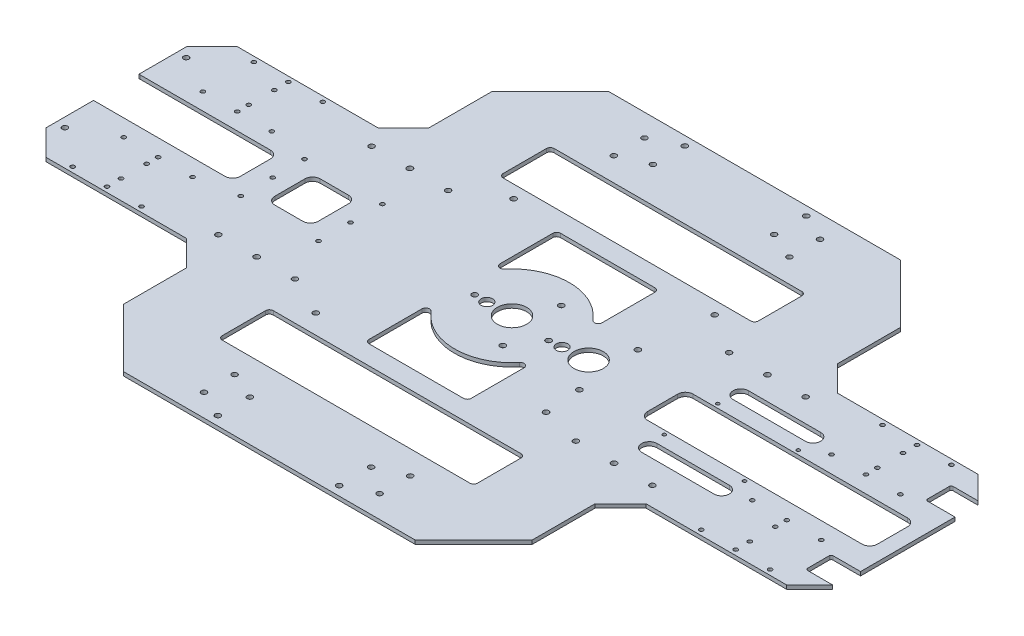
from build123d import *

# Parameters (mm, degrees)
EXTRUDE_1_DEPTH      = 3
CHAMFER_1_SIZE       = 20
SKETCH_2_W           = 320
SKETCH_2_H           = 20
CUT_EXTRUDE_1_DEPTH  = 5
CHAMFER_2_SIZE       = 50
SKETCH_3_R           = 2.1
SKETCH_3_R_2         = 2.099999999
SKETCH_3_R_3         = 2.100000001
CUT_EXTRUDE_2_DEPTH  = 80
SKETCH_4_R           = 2.15
CUT_EXTRUDE_3_DEPTH  = 10
SKETCH_5_R           = 1.6
SKETCH_5_R_2         = 2.1
SKETCH_5_R_3         = 2.2
CUT_EXTRUDE_4_DEPTH  = 29
EXTRUDE_2_DEPTH      = 3
SKETCH_7_W           = 23
SKETCH_7_H           = 20
CUT_EXTRUDE_5_DEPTH  = 3
FILLET_1_R           = 1.5
SKETCH_9_R           = 2.15
CUT_EXTRUDE_6_DEPTH  = 3
SKETCH_10_R          = 11.5
SKETCH_10_R_2        = 4.5
SKETCH_10_R_3        = 2.15
CUT_EXTRUDE_7_DEPTH  = 5
SKETCH_11_R          = 1.6
CUT_EXTRUDE_8_DEPTH  = 10
SKETCH_13_R          = 1.35
CUT_EXTRUDE_9_DEPTH  = 3
CUT_EXTRUDE_10_DEPTH = 3
CUT_EXTRUDE_START    = -3
SKETCH_15_R          = 2.15
SKETCH_15_R_2        = 4.5
SKETCH_15_R_3        = 11.5
CUT_EXTRUDE_11_DEPTH = 3
CUT_EXTRUDE_12_DEPTH = 3
CUT_EXTRUDE_13_DEPTH = 3


with BuildPart() as part:
    # 草图1 → 凸台-拉伸1 (new body)
    with BuildSketch(Plane(origin=(0, 0, 0), x_dir=(1, 0, 0), z_dir=(0, 1, 0))):
        Polygon((-310, -75), (-160, -75), (-160, -200), (160, -200), (160, -75), (310, -75), (310, 75), (160, 75), (160, 200), (-160, 200), (-160, 75), (-310, 75), align=None)
    extrude(amount=EXTRUDE_1_DEPTH)

    # 倒角1
    chamfer_1_edges = [part.edges().sort_by_distance(p)[0] for p in [
        (-160, 1.5, -75),
        (-310, 1.5, -75),
        (-310, 1.5, 75),
        (-160, 1.5, 75),
        (160, 1.5, 75),
        (160, 1.5, -75),
        (310, 1.5, 75),
        (310, 1.5, -75),
    ]]
    chamfer(chamfer_1_edges, length=CHAMFER_1_SIZE)

    # 草图2 → 切除-拉伸1 (cut)
    with BuildSketch(Plane(origin=(0, 3, 0), x_dir=(1, 0, 0), z_dir=(0, 1, 0))):
        with Locations((0, 190)):
            Rectangle(SKETCH_2_W, SKETCH_2_H)
        with Locations((0, -190)):
            Rectangle(SKETCH_2_W, SKETCH_2_H)
    extrude(amount=-CUT_EXTRUDE_1_DEPTH, mode=Mode.SUBTRACT)

    # 倒角2
    chamfer_2_edges = [part.edges().sort_by_distance(p)[0] for p in [
        (-160, 1.5, -180),
        (-160, 1.5, 180),
        (160, 1.5, -180),
        (160, 1.5, 180),
    ]]
    chamfer(chamfer_2_edges, length=CHAMFER_2_SIZE)

    # 草图3 → 切除-拉伸2 (cut)
    with BuildSketch(Plane(origin=(0, 3, 0), x_dir=(1, 0, 0), z_dir=(0, 1, 0))):
        with Locations((-327.700177837, 47.5)):
            Circle(SKETCH_3_R)
        with Locations((-302.700177837, 47.5)):
            Circle(SKETCH_3_R)
        with Locations((-47.5, 182.826293853)):
            Circle(SKETCH_3_R)
        with Locations((-47.5, 157.826293853)):
            Circle(SKETCH_3_R)
        with Locations((47.5, 182.826293853)):
            Circle(SKETCH_3_R)
        with Locations((47.5, 157.826293853)):
            Circle(SKETCH_3_R)
        with Locations((302.700177837, 47.5)):
            Circle(SKETCH_3_R_2)
        with Locations((327.700177837, 47.5)):
            Circle(SKETCH_3_R_2)
        with Locations((-68.75, 172.5)):
            Circle(SKETCH_3_R)
        with Locations((-68.75, 148.5)):
            Circle(SKETCH_3_R)
        with Locations((68.75, 172.5)):
            Circle(SKETCH_3_R)
        with Locations((68.75, 148.5)):
            Circle(SKETCH_3_R)
        with Locations((68.75, -148.5)):
            Circle(SKETCH_3_R)
        with Locations((68.75, -172.5)):
            Circle(SKETCH_3_R)
        with Locations((-68.75, -148.5)):
            Circle(SKETCH_3_R)
        with Locations((-68.75, -172.5)):
            Circle(SKETCH_3_R)
        with Locations((327.700177837, -47.5)):
            Circle(SKETCH_3_R_3)
        with Locations((302.700177837, -47.5)):
            Circle(SKETCH_3_R_3)
        with Locations((47.5, -157.826293853)):
            Circle(SKETCH_3_R)
        with Locations((47.5, -182.826293853)):
            Circle(SKETCH_3_R)
        with Locations((-47.5, -157.826293853)):
            Circle(SKETCH_3_R)
        with Locations((-47.5, -182.826293853)):
            Circle(SKETCH_3_R)
        with Locations((-302.700177837, -47.5)):
            Circle(SKETCH_3_R)
        with Locations((-327.700177837, -47.5)):
            Circle(SKETCH_3_R)
    extrude(amount=-CUT_EXTRUDE_2_DEPTH, mode=Mode.SUBTRACT)

    # 草图4 → 切除-拉伸3 (cut)
    with BuildSketch(Plane.XZ):
        with Locations((-78.739999994, 74.909999989)):
            Circle(SKETCH_4_R)
        with Locations((-78.739999994, -80.01)):
            Circle(SKETCH_4_R)
        with Locations((78.740000006, -80.01)):
            Circle(SKETCH_4_R)
        with Locations((78.740000006, 52.07)):
            Circle(SKETCH_4_R)
    extrude(amount=-CUT_EXTRUDE_3_DEPTH, mode=Mode.SUBTRACT)

    # 草图5 → 切除-拉伸4 (cut)
    with BuildSketch(Plane(origin=(0, 3, 0), x_dir=(1, 0, 0), z_dir=(0, 1, 0))):
        with Locations((219.200177837, 71)):
            Circle(SKETCH_5_R)
        with Locations((273.200177837, 71)):
            Circle(SKETCH_5_R)
        with Locations((246.200177837, 71)):
            Circle(SKETCH_5_R)
        with Locations((219.200177837, 30.998400192)):
            Circle(SKETCH_5_R)
        with Locations((246.200177837, 30.998400192)):
            Circle(SKETCH_5_R)
        with Locations((273.200177837, 30.998400192)):
            Circle(SKETCH_5_R)
        with Locations((246.200177837, 60)):
            Circle(SKETCH_5_R)
        with Locations((246.200177837, 40)):
            Circle(SKETCH_5_R)
        with Locations((246.200177837, -40)):
            Circle(SKETCH_5_R)
        with Locations((246.200177837, -60)):
            Circle(SKETCH_5_R)
        with Locations((273.200177837, -30.998400192)):
            Circle(SKETCH_5_R)
        with Locations((246.200177837, -30.998400192)):
            Circle(SKETCH_5_R)
        with Locations((219.200177837, -30.998400192)):
            Circle(SKETCH_5_R)
        with Locations((246.200177837, -71)):
            Circle(SKETCH_5_R)
        with Locations((273.200177837, -71)):
            Circle(SKETCH_5_R)
        with Locations((219.200177837, -71)):
            Circle(SKETCH_5_R)
        with Locations((-219.200177837, -71)):
            Circle(SKETCH_5_R)
        with Locations((-273.200177837, -71)):
            Circle(SKETCH_5_R)
        with Locations((-246.200177837, -71)):
            Circle(SKETCH_5_R)
        with Locations((-219.200177837, -30.998400192)):
            Circle(SKETCH_5_R)
        with Locations((-246.200177837, -30.998400192)):
            Circle(SKETCH_5_R)
        with Locations((-273.200177837, -30.998400192)):
            Circle(SKETCH_5_R)
        with Locations((-246.200177837, -60)):
            Circle(SKETCH_5_R)
        with Locations((-246.200177837, -40)):
            Circle(SKETCH_5_R)
        with Locations((-246.200177837, 40)):
            Circle(SKETCH_5_R)
        with Locations((-246.200177837, 60)):
            Circle(SKETCH_5_R)
        with Locations((-273.200177837, 30.998400192)):
            Circle(SKETCH_5_R)
        with Locations((-246.200177837, 30.998400192)):
            Circle(SKETCH_5_R)
        with Locations((-219.200177837, 30.998400192)):
            Circle(SKETCH_5_R)
        with Locations((-246.200177837, 71)):
            Circle(SKETCH_5_R)
        with Locations((-273.200177837, 71)):
            Circle(SKETCH_5_R)
        with Locations((-219.200177837, 71)):
            Circle(SKETCH_5_R)
        with Locations((170, -60)):
            Circle(SKETCH_5_R_2)
        with Locations((110, -60)):
            Circle(SKETCH_5_R_2)
        with Locations((140, -60)):
            Circle(SKETCH_5_R_3)
        with Locations((140, 60)):
            Circle(SKETCH_5_R_3)
        with Locations((110, 60)):
            Circle(SKETCH_5_R_2)
        with Locations((170, 60)):
            Circle(SKETCH_5_R_2)
        with Locations((-170, 60)):
            Circle(SKETCH_5_R_2)
        with Locations((-110, 60)):
            Circle(SKETCH_5_R_2)
        with Locations((-140, 60)):
            Circle(SKETCH_5_R_3)
        with Locations((-140, -60)):
            Circle(SKETCH_5_R_3)
        with Locations((-110, -60)):
            Circle(SKETCH_5_R_2)
        with Locations((-170, -60)):
            Circle(SKETCH_5_R_2)
    extrude(amount=-CUT_EXTRUDE_4_DEPTH, mode=Mode.SUBTRACT)

    # 草图6 → 凸台-拉伸2 (add)
    with BuildSketch(Plane(origin=(0, 3, 0), x_dir=(1, 0, 0), z_dir=(0, 1, 0))):
        Polygon((-160, 144.142135624), (-160, 130), (-110, 180), (110, 180), (160, 130), (160, 144.142135624), (114.142135624, 190), (-114.142135624, 190), align=None)
        Polygon((114.142135624, -190), (160, -144.142135624), (160, -130), (110, -180), (-110, -180), (-160, -130), (-160, -144.142135624), (-114.142135624, -190), align=None)
    extrude(amount=-EXTRUDE_2_DEPTH)

    # 草图7 → 切除-拉伸5 (cut)
    with BuildSketch(Plane(origin=(0, 3, 0), x_dir=(1, 0, 0), z_dir=(0, 1, 0))):
        with Locations((298.5, 47)):
            Rectangle(SKETCH_7_W, SKETCH_7_H)
        with Locations((298.5, -47)):
            Rectangle(SKETCH_7_W, SKETCH_7_H)
    extrude(amount=-CUT_EXTRUDE_5_DEPTH, mode=Mode.SUBTRACT)

    # 圆角1
    fillet_1_edges = [part.edges().sort_by_distance(p)[0] for p in [
        (287, 1.5, 37),
        (287, 1.5, 57),
        (287, 1.5, -37),
        (287, 1.5, -57),
    ]]
    fillet(fillet_1_edges, radius=FILLET_1_R)

    # 草图9 → 切除-拉伸6 (cut)
    with BuildSketch(Plane.XZ):
        with Locations((-47.500000014, 182.878427071)):
            Circle(SKETCH_9_R)
        with Locations((47.499999986, 182.878427071)):
            Circle(SKETCH_9_R)
        with Locations((47.499999986, -182.878427071)):
            Circle(SKETCH_9_R)
        with Locations((-47.500000014, -182.878427071)):
            Circle(SKETCH_9_R)
    extrude(amount=-CUT_EXTRUDE_6_DEPTH, mode=Mode.SUBTRACT)

    # 草图10 → 切除-拉伸7 (cut)
    with BuildSketch(Plane.XZ):
        with Locations((60, 0)):
            Circle(SKETCH_10_R)
        with Locations((40.818485661, 1.62234634)):
            Circle(SKETCH_10_R_2)
        with Locations((72.33180035, -26.247413208)):
            Circle(SKETCH_10_R_3)
        with Locations((76.565026447, 23.803358982)):
            Circle(SKETCH_10_R_3)
        with Locations((31.103173203, 2.444054227)):
            Circle(SKETCH_10_R_3)
    extrude(amount=-CUT_EXTRUDE_7_DEPTH, mode=Mode.SUBTRACT)

    # 草图11 → 切除-拉伸8 (cut)
    with BuildSketch(Plane.XZ):
        with Locations((-126.5, -25)):
            Circle(SKETCH_11_R)
        with Locations((-187.5, -25)):
            Circle(SKETCH_11_R)
        with Locations((-126.5, 0)):
            Circle(SKETCH_11_R)
        with Locations((-187.4745166, 0)):
            Circle(SKETCH_11_R)
        with Locations((-187.4745166, 25)):
            Circle(SKETCH_11_R)
        with Locations((-126.5, 25)):
            Circle(SKETCH_11_R)
    extrude(amount=-CUT_EXTRUDE_8_DEPTH, mode=Mode.SUBTRACT)

    # 草图13 → 切除-拉伸9 (cut)
    with BuildSketch(Plane(origin=(0, 3, 0), x_dir=(1, 0, 0), z_dir=(0, 1, 0))):
        with Locations((140.200177837, 21)):
            Circle(SKETCH_13_R)
        with Locations((203.200177837, 21)):
            Circle(SKETCH_13_R)
        with Locations((203.200177837, -21)):
            Circle(SKETCH_13_R)
        with Locations((140.200177837, -21)):
            Circle(SKETCH_13_R)
        with BuildLine():
            Line((143.400177837, 41.8), (200.000177837, 41.8))
            ThreePointArc((200.000177837, 41.8), (206.000177837, 35.8), (200.000177837, 29.8))
            Line((200.000177837, 29.8), (143.400177837, 29.8))
            ThreePointArc((143.400177837, 29.8), (137.400177837, 35.8), (143.400177837, 41.8))
        make_face()
        with BuildLine():
            Line((143.400177837, -29.8), (200.000177837, -29.8))
            ThreePointArc((200.000177837, -29.8), (206.000177837, -35.8), (200.000177837, -41.8))
            Line((200.000177837, -41.8), (143.400177837, -41.8))
            ThreePointArc((143.400177837, -41.8), (137.400177837, -35.8), (143.400177837, -29.8))
        make_face()
    extrude(amount=-CUT_EXTRUDE_9_DEPTH, mode=Mode.SUBTRACT)

    # 草图14 → 切除-拉伸10 (cut)
    with BuildSketch(Plane(origin=(0, 3, 0), x_dir=(1, 0, 0), z_dir=(0, 1, 0))):
        with BuildLine():
            Line((292, 17.8), (124, 17.8))
            ThreePointArc((124, 17.8), (119.757359313, 16.042640687), (118, 11.8))
            Line((118, 11.8), (118, -11.8))
            ThreePointArc((118, -11.8), (119.757359313, -16.042640687), (124, -17.8))
            Line((124, -17.8), (292, -17.8))
            ThreePointArc((292, -17.8), (296.242640687, -16.042640687), (298, -11.8))
            Line((298, -11.8), (298, 11.8))
            ThreePointArc((298, 11.8), (296.242640687, 16.042640687), (292, 17.8))
        make_face()
    extrude(amount=-CUT_EXTRUDE_10_DEPTH, mode=Mode.SUBTRACT)

    # 草图15 → 切除-拉伸11 (cut)
    with BuildSketch(Plane(origin=(0, 3, 0), x_dir=(1, 0, 0), z_dir=(0, 1, 0)).offset(CUT_EXTRUDE_START)):
        with Locations((76.565026447, -23.803358982)):
            Circle(SKETCH_15_R)
        with Locations((72.33180035, 26.247413208)):
            Circle(SKETCH_15_R)
        with Locations((31.103173203, -2.444054227)):
            Circle(SKETCH_15_R)
        with Locations((40.818485661, -1.62234634)):
            Circle(SKETCH_15_R_2)
        with Locations((60, 0)):
            Circle(SKETCH_15_R_3)
        with Locations((16.565026447, -23.803358982)):
            Circle(SKETCH_15_R)
        with Locations((12.33180035, 26.247413208)):
            Circle(SKETCH_15_R)
        with Locations((-28.896826797, -0.34594168)):
            Circle(SKETCH_15_R)
        with Locations((-19.181514339, -0.523817525)):
            Circle(SKETCH_15_R_2)
        Circle(SKETCH_15_R_3)
    extrude(amount=CUT_EXTRUDE_11_DEPTH, mode=Mode.SUBTRACT)

    # 草图16 → 切除-拉伸12 (cut)
    with BuildSketch(Plane(origin=(0, 3, 0), x_dir=(1, 0, 0), z_dir=(0, 1, 0))):
        with BuildLine():
            Line((97, 130), (-97, 130))
            ThreePointArc((-97, 130), (-99.121320344, 129.121320344), (-100, 127))
            Line((-100, 127), (-100, 93))
            ThreePointArc((-100, 93), (-99.121320344, 90.878679656), (-97, 90))
            Line((-97, 90), (97, 90))
            ThreePointArc((97, 90), (99.121320344, 90.878679656), (100, 93))
            Line((100, 93), (100, 127))
            ThreePointArc((100, 127), (99.121320344, 129.121320344), (97, 130))
        make_face()
        with BuildLine():
            Line((97, -90), (-97, -90))
            ThreePointArc((-97, -90), (-99.121320344, -90.878679656), (-100, -93))
            Line((-100, -93), (-100, -127))
            ThreePointArc((-100, -127), (-99.121320344, -129.121320344), (-97, -130))
            Line((-97, -130), (97, -130))
            ThreePointArc((97, -130), (99.121320344, -129.121320344), (100, -127))
            Line((100, -127), (100, -93))
            ThreePointArc((100, -93), (99.121320344, -90.878679656), (97, -90))
        make_face()
        with BuildLine():
            ThreePointArc((-37, 75), (-39.121320344, 74.121320344), (-40, 72))
            Line((-40, 72), (-40, 30.577769703))
            ThreePointArc((-40, 30.577769703), (-38.015504801, 27.754872255), (-34.6875, 28.666659096))
            ThreePointArc((-34.6875, 28.666659096), (0, 45), (34.6875, 28.666659096))
            ThreePointArc((34.6875, 28.666659096), (38.015504801, 27.754872255), (40, 30.577769703))
            Line((40, 30.577769703), (40, 72))
            ThreePointArc((40, 72), (39.121320344, 74.121320344), (37, 75))
            Line((37, 75), (-37, 75))
        make_face()
        with BuildLine():
            ThreePointArc((-34.6875, -28.666659096), (-38.015504801, -27.754872255), (-40, -30.577769703))
            Line((-40, -30.577769703), (-40, -72))
            ThreePointArc((-40, -72), (-39.121320344, -74.121320344), (-37, -75))
            Line((-37, -75), (37, -75))
            ThreePointArc((37, -75), (39.121320344, -74.121320344), (40, -72))
            Line((40, -72), (40, -30.577769703))
            ThreePointArc((40, -30.577769703), (38.015504801, -27.754872255), (34.6875, -28.666659096))
            ThreePointArc((34.6875, -28.666659096), (0, -45), (-34.6875, -28.666659096))
        make_face()
    extrude(amount=-CUT_EXTRUDE_12_DEPTH, mode=Mode.SUBTRACT)

    # 草图17 → 切除-拉伸13 (cut)
    with BuildSketch(Plane(origin=(0, 3, 0), x_dir=(1, 0, 0), z_dir=(0, 1, 0))):
        with BuildLine():
            Line((-308.827907457, 17.8), (-207, 17.8))
            ThreePointArc((-207, 17.8), (-202.757359313, 16.042640687), (-201, 11.8))
            Line((-201, 11.8), (-201, -11.8))
            ThreePointArc((-201, -11.8), (-202.757359313, -16.042640687), (-207, -17.8))
            Line((-207, -17.8), (-308.827907457, -17.8))
            ThreePointArc((-308.827907457, -17.8), (-313.070548144, -16.042640687), (-314.827907457, -11.8))
            Line((-314.827907457, -11.8), (-314.827907457, 11.8))
            ThreePointArc((-314.827907457, 11.8), (-313.070548144, 16.042640687), (-308.827907457, 17.8))
        make_face()
        with BuildLine():
            Line((-168, 17.8), (-146, 17.8))
            ThreePointArc((-146, 17.8), (-141.757359313, 16.042640687), (-140, 11.8))
            Line((-140, 11.8), (-140, -11.8))
            ThreePointArc((-140, -11.8), (-141.757359313, -16.042640687), (-146, -17.8))
            Line((-146, -17.8), (-168, -17.8))
            ThreePointArc((-168, -17.8), (-172.242640687, -16.042640687), (-174, -11.8))
            Line((-174, -11.8), (-174, 11.8))
            ThreePointArc((-174, 11.8), (-172.242640687, 16.042640687), (-168, 17.8))
        make_face()
    extrude(amount=-CUT_EXTRUDE_13_DEPTH, mode=Mode.SUBTRACT)


solid = part.part
